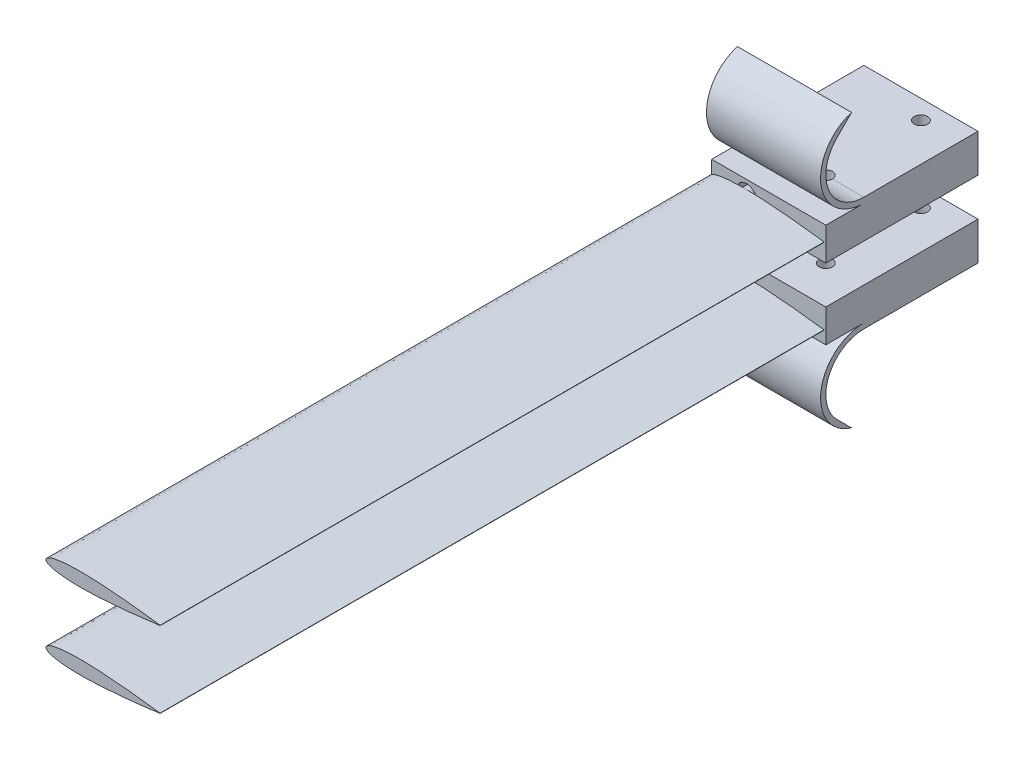
from build123d import *

# Parameters (mm, degrees)
BOSS_EXTRUDE1_DEPTH             = 215
BOSS_EXTRUDE2_DEPTH             = 5
BOSS_EXTRUDE2_DEPTH_BACK        = 5
SKETCH3_W                       = 30
SKETCH3_H                       = 30
BOSS_EXTRUDE3_REACH             = 218.538
BOSS_EXTRUDE3_DIRECTION_2_REACH = 218.538
BOSS_EXTRUDE4_DEPTH             = 10
CUT_EXTRUDE1_DEPTH              = 10
CUT_EXTRUDE1_DEPTH_BACK         = 5
CUT_EXTRUDE2_REACH              = 220.675
CUT_EXTRUDE2_END_RADIUS         = 4.373054583
SKETCH10_W                      = 3.507243881
SKETCH10_H                      = 10.817523295
SKETCH11_R                      = 1.75
CUT_EXTRUDE3_DEPTH              = 219.675412154


with BuildPart() as part:
    # Sketch2 → Boss-Extrude1 (new body)
    with BuildSketch(Plane.XY):
        with BuildLine():
            Line((25.271786489, 0.037718364), (25.271786489, -0.037881636))
            add(Edge.make_bspline(
                [(25.271786489, 0.037718364), (25.265946529, 0.038538651), (25.242607679, 0.041816853), (25.149461492, 0.054844235), (25.010024383, 0.074317374), (24.824583749, 0.099891114), (24.634303463, 0.12605238), (24.410469257, 0.156536466), (24.153611636, 0.191145928), (23.864338887, 0.229732769), (23.543323352, 0.272019957), (23.191313008, 0.317808857), (22.809122697, 0.366731925), (22.241912553, 0.43832186), (21.637567273, 0.512616878), (20.997485164, 0.589247536), (20.479151664, 0.650105615), (19.936960736, 0.712401161), (19.372209546, 0.775975081), (18.786199365, 0.840371325), (18.180317425, 0.905416939), (17.555955055, 0.970647095), (16.914584006, 1.035940912), (16.257694343, 1.100794905), (15.586830599, 1.165005382), (14.903550641, 1.228126374), (14.209448394, 1.289951515), (13.50614921, 1.349969704), (12.795292058, 1.407912487), (12.078546163, 1.463409832), (11.357576372, 1.516016235), (10.634076994, 1.565401752), (9.909736937, 1.6111719), (8.947283182, 1.666660997), (7.989163996, 1.713473952), (6.80620551, 1.759026182), (5.874913692, 1.784678564), (4.956897616, 1.798016436), (4.285987299, 1.801531177), (3.629051572, 1.798424061), (2.987627911, 1.788555389), (2.363219379, 1.771626921), (1.757270389, 1.747713569), (1.171194843, 1.716643509), (0.606357201, 1.678503826), (0.064087527, 1.633302473), (-0.454353434, 1.581121605), (-0.947761068, 1.522159166), (-1.414997877, 1.456654824), (-1.854963163, 1.384730684), (-2.266648608, 1.306746212), (-2.649106725, 1.222994639), (-3.001443678, 1.133759877), (-3.322880912, 1.039441682), (-3.612709659, 0.940353284), (-3.870311843, 0.836836913), (-4.095177529, 0.729191193), (-4.286878319, 0.617640239), (-4.445190983, 0.50237315), (-4.569809621, 0.38320032), (-4.66043371, 0.259784151), (-4.715841421, 0.131521399), (-4.734244186, -8.1636e-05), (-4.715841421, -0.131684671), (-4.66043371, -0.259947423), (-4.569809621, -0.383363592), (-4.445190983, -0.502536422), (-4.286878319, -0.617803511), (-4.095177529, -0.729354465), (-3.870311843, -0.837000185), (-3.612709659, -0.940516556), (-3.322880912, -1.039604954), (-3.001443678, -1.133923149), (-2.649106725, -1.223157911), (-2.266648608, -1.306909484), (-1.854963163, -1.384893956), (-1.414997877, -1.456818096), (-0.947761068, -1.522322438), (-0.454353434, -1.581284877), (0.064087527, -1.633465745), (0.606357201, -1.678667098), (1.171194843, -1.716806781), (1.757270389, -1.747876841), (2.363219379, -1.771790193), (2.987627911, -1.788718661), (3.629051572, -1.798587333), (4.285987299, -1.801694449), (4.956897616, -1.798179708), (5.874913692, -1.784841836), (7.045468196, -1.752598977), (8.228268838, -1.702643205), (9.186232818, -1.653047919), (9.909736937, -1.611335172), (10.634076994, -1.565565024), (11.357576372, -1.516179507), (12.078546163, -1.463573104), (12.795292058, -1.408075759), (13.50614921, -1.350132976), (14.209448394, -1.290114786), (14.903550641, -1.228289646), (15.586830599, -1.165168654), (16.257694343, -1.100958177), (16.914584006, -1.036104184), (17.555955055, -0.970810367), (18.180317425, -0.905580211), (18.786199365, -0.840534597), (19.372209546, -0.776138353), (19.936960736, -0.712564433), (20.479151664, -0.650268887), (20.997485164, -0.589410808), (21.637567273, -0.51278015), (22.241912553, -0.438485132), (22.809122697, -0.366895197), (23.191313008, -0.317972128), (23.543323352, -0.272183229), (23.864338887, -0.22989604), (24.153611636, -0.1913092), (24.410469257, -0.156699738), (24.634303463, -0.126215652), (24.824583749, -0.100054385), (25.010024383, -0.074480646), (25.149461492, -0.055007507), (25.242607679, -0.041980125), (25.265946529, -0.038701923), (25.271786489, -0.037881636)],
                knots=[0, 0, 0, 0, 0.000289201, 0.001155766, 0.004612322, 0.007193518, 0.010335793, 0.014031397, 0.018271612, 0.023045847, 0.028342901, 0.03415012, 0.04045376, 0.04723833, 0.062186613, 0.070313724, 0.078851908, 0.087780126, 0.097077521, 0.106722049, 0.116690868, 0.126960505, 0.137507218, 0.148306055, 0.159330765, 0.17055649, 0.181956531, 0.193504043, 0.205171367, 0.2169323, 0.228758169, 0.2406214, 0.252494936, 0.264350287, 0.287897994, 0.299535854, 0.322404759, 0.333584032, 0.344559266, 0.35530596, 0.365799778, 0.37601757, 0.3859373, 0.395537659, 0.404797976, 0.413698812, 0.422221441, 0.430349273, 0.438066019, 0.445356904, 0.452209372, 0.458611567, 0.464554044, 0.47002985, 0.475034902, 0.479569141, 0.483636857, 0.487250263, 0.490431338, 0.493218828, 0.495674086, 0.497891368, 0.5, 0.502108632, 0.504325914, 0.506781172, 0.509568662, 0.512749737, 0.516363143, 0.520430859, 0.524965098, 0.52997015, 0.535445956, 0.541388433, 0.547790628, 0.554643096, 0.561933981, 0.569650727, 0.577778559, 0.586301188, 0.595202024, 0.604462341, 0.6140627, 0.62398243, 0.634200222, 0.64469404, 0.655440734, 0.666415968, 0.677595241, 0.700464146, 0.723839427, 0.735649713, 0.747505064, 0.7593786, 0.771241831, 0.7830677, 0.794828633, 0.806495957, 0.818043469, 0.82944351, 0.840669235, 0.851693945, 0.862492782, 0.873039495, 0.883309132, 0.893277951, 0.902922479, 0.912219874, 0.921148092, 0.929686276, 0.937813387, 0.95276167, 0.95954624, 0.96584988, 0.971657099, 0.976954153, 0.981728388, 0.985968603, 0.989664207, 0.992806482, 0.995387678, 0.998844234, 0.999710799, 1, 1, 1, 1], degree=3))
        make_face()
    extrude(amount=BOSS_EXTRUDE1_DEPTH)

    # Sketch3 → Boss-Extrude2 (add, two sides: drawn at the far end of the back side and taken through both)
    with BuildSketch(Plane(origin=(0, 0, 0), x_dir=(1, 0, 0), z_dir=(0, 1, 0)).offset(-BOSS_EXTRUDE2_DEPTH_BACK)):
        with Locations((10.271786489, -15)):
            Rectangle(SKETCH3_W, SKETCH3_H)
    extrude(amount=BOSS_EXTRUDE2_DEPTH + BOSS_EXTRUDE2_DEPTH_BACK)

    # Boss-Extrude3: up to this face of the body (flat: up to its plane)
    boss_extrude3_end = Plane(part.part.faces().sort_by_distance((25.271786489, -3.636e-06, 19.788414133))[0])
    # Sketch5 → Boss-Extrude3 (add, up to the picked face)
    with BuildSketch(Plane(origin=(0, 0, 0), x_dir=(0, 0, -1), z_dir=(1, 0, 0)), mode=Mode.PRIVATE) as boss_extrude3_sk1:
        with BuildLine():
            Line((-33.234650441, -25.907485183), (-37.071067812, -22.071067812))
            ThreePointArc((-37.071067812, -22.071067812), (-39.238795325, -11.173165676), (-30, -5))
            Line((-30, -5), (-30, -3.622997034))
            ThreePointArc((-30, -3.622997034), (-41.259011674, -13.365725664), (-33.234650441, -25.907485183))
        make_face()
    boss_extrude3_tool1 = split(extrude(boss_extrude3_sk1.sketch, amount=BOSS_EXTRUDE3_REACH, mode=Mode.PRIVATE), bisect_by=boss_extrude3_end, keep=Keep.BOTH, mode=Mode.PRIVATE)
    add(boss_extrude3_tool1.solids().sort_by(Axis((0, -24.166199, 35.329782), (1, 0, 0)))[0])

    # Boss-Extrude3 direction 2: up to this face of the body (flat: up to its plane)
    boss_extrude3_direction_2_end = Plane(part.part.faces().sort_by_distance((-4.728213511, 0, 15))[0])
    # Sketch5 → Boss-Extrude3 direction 2 (add, up to the picked face)
    with BuildSketch(Plane(origin=(0, 0, 0), x_dir=(0, 0, -1), z_dir=(1, 0, 0)), mode=Mode.PRIVATE) as boss_extrude3_direction_2_sk1:
        with BuildLine():
            Line((-33.234650441, -25.907485183), (-37.071067812, -22.071067812))
            ThreePointArc((-37.071067812, -22.071067812), (-39.238795325, -11.173165676), (-30, -5))
            Line((-30, -5), (-30, -3.622997034))
            ThreePointArc((-30, -3.622997034), (-41.259011674, -13.365725664), (-33.234650441, -25.907485183))
        make_face()
    boss_extrude3_direction_2_tool1 = split(extrude(boss_extrude3_direction_2_sk1.sketch, amount=-BOSS_EXTRUDE3_DIRECTION_2_REACH, mode=Mode.PRIVATE), bisect_by=boss_extrude3_direction_2_end, keep=Keep.BOTH, mode=Mode.PRIVATE)
    add(boss_extrude3_direction_2_tool1.solids().sort_by(Axis((0, -24.166199, 35.329782), (-1, 0, 0)))[0])

    # Sketch6 → Boss-Extrude4 (add)
    with BuildSketch(Plane.XY.offset(30)):
        with BuildLine():
            add(Edge.make_bspline(
                [(25.271786489, 0.037718364), (25.265946529, 0.038538651), (25.242607679, 0.041816853), (25.149461492, 0.054844235), (25.010024383, 0.074317374), (24.824583749, 0.099891114), (24.634303463, 0.12605238), (24.410469257, 0.156536466), (24.153611636, 0.191145928), (23.864338887, 0.229732769), (23.543323352, 0.272019957), (23.191313008, 0.317808857), (22.809122697, 0.366731925), (22.241912553, 0.43832186), (21.637567273, 0.512616878), (20.997485164, 0.589247536), (20.479151664, 0.650105615), (19.936960736, 0.712401161), (19.372209546, 0.775975081), (18.786199365, 0.840371325), (18.180317425, 0.905416939), (17.555955055, 0.970647095), (16.914584006, 1.035940912), (16.257694343, 1.100794905), (15.586830599, 1.165005382), (14.903550641, 1.228126374), (14.209448394, 1.289951515), (13.50614921, 1.349969704), (12.795292058, 1.407912487), (12.078546163, 1.463409832), (11.357576372, 1.516016235), (10.634076994, 1.565401752), (9.909736937, 1.6111719), (8.947283182, 1.666660997), (7.989163996, 1.713473952), (6.80620551, 1.759026182), (5.874913692, 1.784678564), (4.956897616, 1.798016436), (4.285987299, 1.801531177), (3.629051572, 1.798424061), (2.987627911, 1.788555389), (2.363219379, 1.771626921), (1.757270389, 1.747713569), (1.171194843, 1.716643509), (0.606357201, 1.678503826), (0.064087527, 1.633302473), (-0.454353434, 1.581121605), (-0.947761068, 1.522159166), (-1.414997877, 1.456654824), (-1.854963163, 1.384730684), (-2.266648608, 1.306746212), (-2.649106725, 1.222994639), (-3.001443678, 1.133759877), (-3.322880912, 1.039441682), (-3.612709659, 0.940353284), (-3.870311843, 0.836836913), (-4.095177529, 0.729191193), (-4.286878319, 0.617640239), (-4.445190983, 0.50237315), (-4.569809621, 0.38320032), (-4.66043371, 0.259784151), (-4.715841421, 0.131521399), (-4.728213511, 0.043045313), (-4.728213511, -8.1636e-05)],
                knots=[0, 0, 0, 0, 0.000289201, 0.001155766, 0.004612322, 0.007193518, 0.010335793, 0.014031397, 0.018271612, 0.023045847, 0.028342901, 0.03415012, 0.04045376, 0.04723833, 0.062186613, 0.070313724, 0.078851908, 0.087780126, 0.097077521, 0.106722049, 0.116690868, 0.126960505, 0.137507218, 0.148306055, 0.159330765, 0.17055649, 0.181956531, 0.193504043, 0.205171367, 0.2169323, 0.228758169, 0.2406214, 0.252494936, 0.264350287, 0.287897994, 0.299535854, 0.322404759, 0.333584032, 0.344559266, 0.35530596, 0.365799778, 0.37601757, 0.3859373, 0.395537659, 0.404797976, 0.413698812, 0.422221441, 0.430349273, 0.438066019, 0.445356904, 0.452209372, 0.458611567, 0.464554044, 0.47002985, 0.475034902, 0.479569141, 0.483636857, 0.487250263, 0.490431338, 0.493218828, 0.495674086, 0.497891368, 0.5, 0.5, 0.5, 0.5], degree=3))
            Line((25.271786489, 0.037718364), (25.271786489, 5))
            Line((25.271786489, 5), (-4.728213511, 5))
            Line((-4.728213511, 5), (-4.728213511, -8.1636e-05))
        make_face()
        with BuildLine():
            add(Edge.make_bspline(
                [(-4.728213511, -8.1636e-05), (-4.728213511, -0.043208585), (-4.715841421, -0.131684671), (-4.66043371, -0.259947423), (-4.569809621, -0.383363592), (-4.445190983, -0.502536422), (-4.286878319, -0.617803511), (-4.095177529, -0.729354465), (-3.870311843, -0.837000185), (-3.612709659, -0.940516556), (-3.322880912, -1.039604954), (-3.001443678, -1.133923149), (-2.649106725, -1.223157911), (-2.266648608, -1.306909484), (-1.854963163, -1.384893956), (-1.414997877, -1.456818096), (-0.947761068, -1.522322438), (-0.454353434, -1.581284877), (0.064087527, -1.633465745), (0.606357201, -1.678667098), (1.171194843, -1.716806781), (1.757270389, -1.747876841), (2.363219379, -1.771790193), (2.987627911, -1.788718661), (3.629051572, -1.798587333), (4.285987299, -1.801694449), (4.956897616, -1.798179708), (5.874913692, -1.784841836), (7.045468196, -1.752598977), (8.228268838, -1.702643205), (9.186232818, -1.653047919), (9.909736937, -1.611335172), (10.634076994, -1.565565024), (11.357576372, -1.516179507), (12.078546163, -1.463573104), (12.795292058, -1.408075759), (13.50614921, -1.350132976), (14.209448394, -1.290114786), (14.903550641, -1.228289646), (15.586830599, -1.165168654), (16.257694343, -1.100958177), (16.914584006, -1.036104184), (17.555955055, -0.970810367), (18.180317425, -0.905580211), (18.786199365, -0.840534597), (19.372209546, -0.776138353), (19.936960736, -0.712564433), (20.479151664, -0.650268887), (20.997485164, -0.589410808), (21.637567273, -0.51278015), (22.241912553, -0.438485132), (22.809122697, -0.366895197), (23.191313008, -0.317972128), (23.543323352, -0.272183229), (23.864338887, -0.22989604), (24.153611636, -0.1913092), (24.410469257, -0.156699738), (24.634303463, -0.126215652), (24.824583749, -0.100054385), (25.010024383, -0.074480646), (25.149461492, -0.055007507), (25.242607679, -0.041980125), (25.265946529, -0.038701923), (25.271786489, -0.037881636)],
                knots=[0.5, 0.5, 0.5, 0.5, 0.502108632, 0.504325914, 0.506781172, 0.509568662, 0.512749737, 0.516363143, 0.520430859, 0.524965098, 0.52997015, 0.535445956, 0.541388433, 0.547790628, 0.554643096, 0.561933981, 0.569650727, 0.577778559, 0.586301188, 0.595202024, 0.604462341, 0.6140627, 0.62398243, 0.634200222, 0.64469404, 0.655440734, 0.666415968, 0.677595241, 0.700464146, 0.723839427, 0.735649713, 0.747505064, 0.7593786, 0.771241831, 0.7830677, 0.794828633, 0.806495957, 0.818043469, 0.82944351, 0.840669235, 0.851693945, 0.862492782, 0.873039495, 0.883309132, 0.893277951, 0.902922479, 0.912219874, 0.921148092, 0.929686276, 0.937813387, 0.95276167, 0.95954624, 0.96584988, 0.971657099, 0.976954153, 0.981728388, 0.985968603, 0.989664207, 0.992806482, 0.995387678, 0.998844234, 0.999710799, 1, 1, 1, 1], degree=3))
            Line((-4.728213511, -8.1636e-05), (-4.728213511, -3.622997034))
            Line((-4.728213511, -3.622997034), (25.271786489, -3.622997034))
            Line((25.271786489, -3.622997034), (25.271786489, -0.037881636))
        make_face()
    extrude(amount=BOSS_EXTRUDE4_DEPTH)

    # Sketch7 → Cut-Revolve1 (revolve, cut)
    with BuildSketch(Plane(origin=(0, 0, 0), x_dir=(1, 0, 0), z_dir=(0, 1, 0)), mode=Mode.PRIVATE) as cut_revolve1_sk:
        Polygon((4.42876845, -12.301419842), (4.42876845, -28.964265754), (4.42876845, -40.485808023), (7.095171517, -40.485808023), (7.095171517, -28.964265754), (8.801823033, -28.964265754), (8.801823033, -12.301419842), align=None)
    revolve(cut_revolve1_sk.sketch.rotate(Axis((4.42876845, 0, 6.87280036), (0, 0, 1)), 180), axis=Axis((4.42876845, 0, 6.87280036), (0, 0, 1)), mode=Mode.SUBTRACT)

    # Sketch8 → Cut-Extrude1 (cut, two sides: drawn at the far end of the back side and taken through both)
    with BuildSketch(Plane(origin=(0, 0, 0), x_dir=(1, 0, 0), z_dir=(0, 1, 0)).offset(-CUT_EXTRUDE1_DEPTH_BACK)):
        Polygon((25.271786489, -40), (7.32385055, -40), (-4.728213511, -40), (-4.728213511, -40.485808023), (2.437177866, -40.485808023), (6.424050978, -40.485808023), (25.532503019, -40.485808023), (25.532503019, -40), align=None)
    extrude(amount=CUT_EXTRUDE1_DEPTH + CUT_EXTRUDE1_DEPTH_BACK, mode=Mode.SUBTRACT)


with BuildPart() as cut_extrude1_piece_1:
    # of the separate pieces the step leaves, piece 1, a body of its own (cut_extrude1_pieces)
    add(part.part.solids().sort_by_distance((25.271786489, -0.037881636, 40.485808023))[0])

    # Sketch9 → Revolve2 (revolve)
    with BuildSketch(Plane(origin=(0, 0, 0), x_dir=(1, 0, 0), z_dir=(0, 1, 0)), mode=Mode.PRIVATE) as revolve2_sk:
        Polygon((4.42876845, -13.301419842), (7.801823033, -13.301419842), (7.801823033, -27.964265754), (7.095171517, -27.964265754), (6.095171517, -27.964265754), (6.095171517, -28.964265754), (6.095171517, -40.485808023), (4.42876845, -40.485808023), align=None)
    revolve(revolve2_sk.sketch.rotate(Axis((4.42876845, 0, 13.301419842), (0, 0, 1)), 180), axis=Axis((4.42876845, 0, 13.301419842), (0, 0, 1)))


with BuildPart() as cut_extrude1_piece_2:
    # of the separate pieces the step leaves, piece 2, a body of its own (cut_extrude1_pieces)
    add(part.part.solids().sort_by_distance((25.271786489, -5, 0))[0])

    # Cut-Extrude2: up to this cylinder (the profile starts outside it)
    cut_extrude2_end = Plane(origin=(4.42876845, 0, 20.675165), z_dir=(0, 0, -1)) * Cylinder(CUT_EXTRUDE2_END_RADIUS, 451.096109166, mode=Mode.PRIVATE)
    # Sketch10 → Cut-Extrude2 (cut, up to the surface)
    with BuildSketch(Plane(origin=(0, 5, 0), x_dir=(1, 0, 0), z_dir=(0, 1, 0)), mode=Mode.PRIVATE) as cut_extrude2_sk1:
        with Locations((4.544823367, -20.675164886)):
            Rectangle(SKETCH10_W, SKETCH10_H)
    cut_extrude2_tool1 = extrude(cut_extrude2_sk1.sketch, amount=-CUT_EXTRUDE2_REACH, mode=Mode.PRIVATE) - cut_extrude2_end
    add(cut_extrude2_tool1.solids().sort_by_distance((4.544823, 5, 20.675165))[0], mode=Mode.SUBTRACT)

    # Sketch11 → Cut-Extrude3 (cut, through all)
    with BuildSketch(Plane(origin=(0, 5, 0), x_dir=(1, 0, 0), z_dir=(0, 1, 0))):
        with Locations(Location((15.271786489, -5, 0), (0, 0, 270))):
            Circle(SKETCH11_R)
        with Locations(Location((15.271786489, -30, 0), (0, 0, 270))):
            Circle(SKETCH11_R)
    extrude(amount=-CUT_EXTRUDE3_DEPTH, mode=Mode.SUBTRACT)


with BuildPart() as body_3:
    # Mirror1: mirrored copy
    add(cut_extrude1_piece_1.part.mirror(Plane.ZX.offset(10)))


with BuildPart() as body_4:
    # Mirror1 2: mirrored copy
    add(cut_extrude1_piece_2.part.mirror(Plane.ZX.offset(10)))


solid = Compound([cut_extrude1_piece_1.part, cut_extrude1_piece_2.part, body_3.part, body_4.part])
